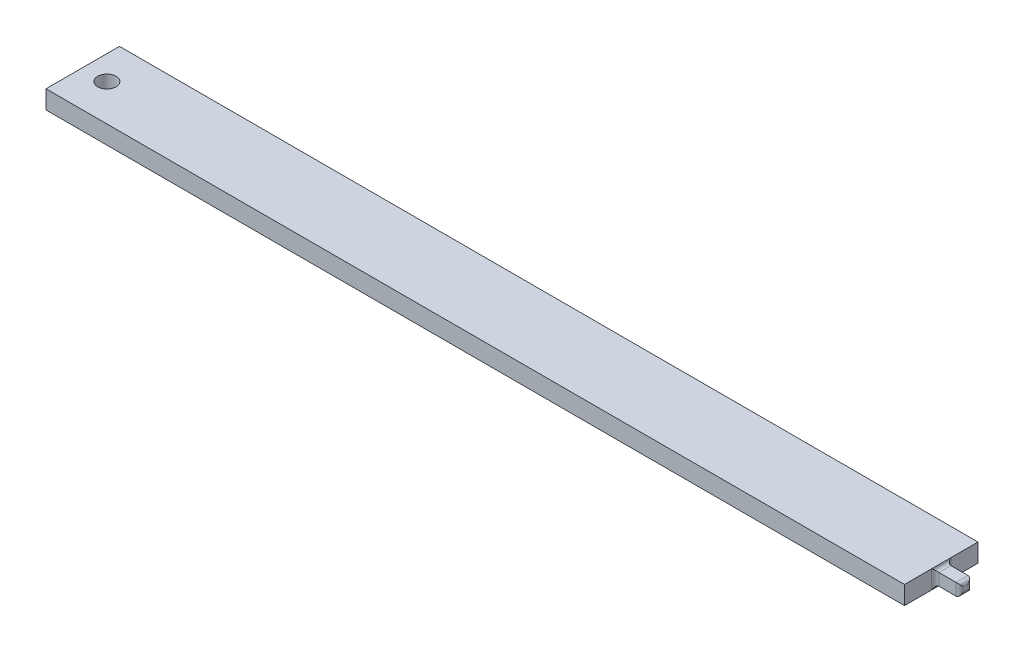
from build123d import *

# Parameters (mm, degrees)
SKETCH1_W           = 280.4
SKETCH1_H           = 12
BOSS_EXTRUDE1_DEPTH = 3
SKETCH3_R           = 1.5
CUT_EXTRUDE1_DEPTH  = 141.360393274
SKETCH6_W           = 140.2
SKETCH6_H           = 12
CUT_EXTRUDE2_DEPTH  = 141.360393274
SKETCH7_W           = 1.95
SKETCH7_H           = 1.95
BOSS_EXTRUDE2_DEPTH = 4
FILLET1_R           = 0.6


with BuildPart() as part:
    # Sketch1 → Boss-Extrude1 (new body)
    with BuildSketch(Plane(origin=(0, 0, 0), x_dir=(1, 0, 0), z_dir=(0, 1, 0))):
        Rectangle(SKETCH1_W, SKETCH1_H)
    extrude(amount=BOSS_EXTRUDE1_DEPTH)

    # Sketch3 → Cut-Extrude1 (cut, through all)
    with BuildSketch(Plane(origin=(0, 3, 0), x_dir=(1, 0, 0), z_dir=(0, 1, 0))):
        with Locations(Location((-136.25, 0, 0), (0, 0, 270))):
            Circle(SKETCH3_R)
        with Locations(Location((136.25, 0, 0), (0, 0, 270))):
            Circle(SKETCH3_R)
    extrude(amount=-CUT_EXTRUDE1_DEPTH, mode=Mode.SUBTRACT)

    # Sketch6 → Cut-Extrude2 (cut, through all)
    with BuildSketch(Plane(origin=(0, 3, 0), x_dir=(1, 0, 0), z_dir=(0, 1, 0))):
        with Locations((70.1, 0)):
            Rectangle(SKETCH6_W, SKETCH6_H)
    extrude(amount=-CUT_EXTRUDE2_DEPTH, mode=Mode.SUBTRACT)

    # Sketch7 → Boss-Extrude2 (add)
    with BuildSketch(Plane(origin=(0, 0, 0), x_dir=(0, 0, -1), z_dir=(1, 0, 0))):
        with Locations((0, 1.5)):
            Rectangle(SKETCH7_W, SKETCH7_H)
    extrude(amount=BOSS_EXTRUDE2_DEPTH)

    # Fillet1
    # the kernel refuses this fillet: 0.6 mm, written as the material it adds along each edge
    with BuildSketch(Plane(origin=(0, 0.525, -0.975), x_dir=(0, 0, -1), z_dir=(0, 1, 0)), Plane(origin=(0, 2.475, 0.975), x_dir=(0, 0, 1), z_dir=(0, -1, 0))) as fillet1_piece_1:
        with BuildLine():
            CenterArc((FILLET1_R, -FILLET1_R), FILLET1_R, 90, 90)
            Line((0, -FILLET1_R), (0, 0))
            Line((0, 0), (FILLET1_R, 0))
        make_face()
    fillet1_piece_1_solid = extrude(amount=1.95, mode=Mode.PRIVATE)
    with BuildSketch(Plane(origin=(0, 2.475, -0.975), x_dir=(0, 1, 0), z_dir=(0, 0, 1)), Plane(origin=(0, 0.525, 0.975), x_dir=(0, -1, 0), z_dir=(0, 0, -1))) as fillet1_piece_2:
        with BuildLine():
            CenterArc((0.6, -0.595294045), FILLET1_R, 97.180755781, 82.819244219)
            Line((0, -0.595294045), (0, 0))
            Line((0, 0), (0.525, 0))
        make_face()
    fillet1_piece_2_solid = extrude(amount=1.95, mode=Mode.PRIVATE)
    with BuildSketch(Plane(origin=(0, -0.975, -0.975), x_dir=(0, 0, -1), z_dir=(0, 1, 0))) as fillet1_piece_3a_section:
        with BuildLine():
            CenterArc((FILLET1_R, -FILLET1_R), FILLET1_R, 90, 90)
            Line((0, -FILLET1_R), (0, 0))
            Line((0, 0), (FILLET1_R, 0))
        make_face()
    fillet1_piece_3a = extrude(amount=3.45, mode=Mode.PRIVATE)
    fillet1_piece_3a = split(fillet1_piece_3a, bisect_by=Plane(origin=(0, 0, -0.975), z_dir=(0, 1, 0)), keep=Keep.TOP, mode=Mode.PRIVATE)
    fillet1_piece_3a = split(fillet1_piece_3a, bisect_by=Plane(origin=(0, 0.525, -0.975), z_dir=(0, -1, 0)), keep=Keep.TOP, mode=Mode.PRIVATE)
    with BuildSketch(Plane(origin=(0, 0.525, 0.975), x_dir=(0, -1, 0), z_dir=(0, 0, -1))) as fillet1_piece_3b_section:
        with BuildLine():
            CenterArc((0.6, -0.595294045), FILLET1_R, 97.180755781, 82.819244219)
            Line((0, -0.595294045), (0, 0))
            Line((0, 0), (0.525, 0))
        make_face()
    fillet1_piece_3b = extrude(amount=3.438235112, mode=Mode.PRIVATE)
    fillet1_piece_3b = split(fillet1_piece_3b, bisect_by=Plane(origin=(0, 0.525, -0.975), z_dir=(0, 0, -1)), keep=Keep.TOP, mode=Mode.PRIVATE)
    fillet1_piece_3 = fillet1_piece_3a & fillet1_piece_3b
    with BuildSketch(Plane(origin=(0, 2.475, -2.463235112), x_dir=(0, 1, 0), z_dir=(0, 0, 1))) as fillet1_piece_4a_section:
        with BuildLine():
            CenterArc((0.6, -0.595294045), FILLET1_R, 97.180755781, 82.819244219)
            Line((0, -0.595294045), (0, 0))
            Line((0, 0), (0.525, 0))
        make_face()
    fillet1_piece_4a = extrude(amount=3.438235112, mode=Mode.PRIVATE)
    fillet1_piece_4a = split(fillet1_piece_4a, bisect_by=Plane(origin=(0, 2.475, -0.975), z_dir=(0, 0, -1)), keep=Keep.TOP, mode=Mode.PRIVATE)
    with BuildSketch(Plane(origin=(0, 0.525, -0.975), x_dir=(0, 0, -1), z_dir=(0, 1, 0))) as fillet1_piece_4b_section:
        with BuildLine():
            CenterArc((FILLET1_R, -FILLET1_R), FILLET1_R, 90, 90)
            Line((0, -FILLET1_R), (0, 0))
            Line((0, 0), (FILLET1_R, 0))
        make_face()
    fillet1_piece_4b = extrude(amount=3.45, mode=Mode.PRIVATE)
    fillet1_piece_4b = split(fillet1_piece_4b, bisect_by=Plane(origin=(0, 3, -0.975), z_dir=(0, -1, 0)), keep=Keep.TOP, mode=Mode.PRIVATE)
    fillet1_piece_4b = split(fillet1_piece_4b, bisect_by=Plane(origin=(0, 2.475, -0.975), z_dir=(0, 1, 0)), keep=Keep.TOP, mode=Mode.PRIVATE)
    fillet1_piece_4 = fillet1_piece_4a & fillet1_piece_4b
    with BuildSketch(Plane(origin=(0, 3.975, 0.975), x_dir=(0, 0, 1), z_dir=(0, -1, 0))) as fillet1_piece_5a_section:
        with BuildLine():
            CenterArc((FILLET1_R, -FILLET1_R), FILLET1_R, 90, 90)
            Line((0, -FILLET1_R), (0, 0))
            Line((0, 0), (FILLET1_R, 0))
        make_face()
    fillet1_piece_5a = extrude(amount=3.45, mode=Mode.PRIVATE)
    fillet1_piece_5a = split(fillet1_piece_5a, bisect_by=Plane(origin=(0, 3, 0.975), z_dir=(0, -1, 0)), keep=Keep.TOP, mode=Mode.PRIVATE)
    fillet1_piece_5a = split(fillet1_piece_5a, bisect_by=Plane(origin=(0, 2.475, 0.975), z_dir=(0, 1, 0)), keep=Keep.TOP, mode=Mode.PRIVATE)
    with BuildSketch(Plane(origin=(0, 2.475, -0.975), x_dir=(0, 1, 0), z_dir=(0, 0, 1))) as fillet1_piece_5b_section:
        with BuildLine():
            CenterArc((0.6, -0.595294045), FILLET1_R, 97.180755781, 82.819244219)
            Line((0, -0.595294045), (0, 0))
            Line((0, 0), (0.525, 0))
        make_face()
    fillet1_piece_5b = extrude(amount=3.438235112, mode=Mode.PRIVATE)
    fillet1_piece_5b = split(fillet1_piece_5b, bisect_by=Plane(origin=(0, 2.475, 0.975), z_dir=(0, 0, 1)), keep=Keep.TOP, mode=Mode.PRIVATE)
    fillet1_piece_5 = fillet1_piece_5a & fillet1_piece_5b
    with BuildSketch(Plane(origin=(0, 2.475, 0.975), x_dir=(0, 0, 1), z_dir=(0, -1, 0))) as fillet1_piece_6a_section:
        with BuildLine():
            CenterArc((FILLET1_R, -FILLET1_R), FILLET1_R, 90, 90)
            Line((0, -FILLET1_R), (0, 0))
            Line((0, 0), (FILLET1_R, 0))
        make_face()
    fillet1_piece_6a = extrude(amount=3.45, mode=Mode.PRIVATE)
    fillet1_piece_6a = split(fillet1_piece_6a, bisect_by=Plane(origin=(0, 0, 0.975), z_dir=(0, 1, 0)), keep=Keep.TOP, mode=Mode.PRIVATE)
    fillet1_piece_6a = split(fillet1_piece_6a, bisect_by=Plane(origin=(0, 0.525, 0.975), z_dir=(0, -1, 0)), keep=Keep.TOP, mode=Mode.PRIVATE)
    with BuildSketch(Plane(origin=(0, 0.525, 2.463235112), x_dir=(0, -1, 0), z_dir=(0, 0, -1))) as fillet1_piece_6b_section:
        with BuildLine():
            CenterArc((0.6, -0.595294045), FILLET1_R, 97.180755781, 82.819244219)
            Line((0, -0.595294045), (0, 0))
            Line((0, 0), (0.525, 0))
        make_face()
    fillet1_piece_6b = extrude(amount=3.438235112, mode=Mode.PRIVATE)
    fillet1_piece_6b = split(fillet1_piece_6b, bisect_by=Plane(origin=(0, 0.525, 0.975), z_dir=(0, 0, 1)), keep=Keep.TOP, mode=Mode.PRIVATE)
    fillet1_piece_6 = fillet1_piece_6a & fillet1_piece_6b
    add([fillet1_piece_1_solid, fillet1_piece_2_solid, fillet1_piece_3, fillet1_piece_4, fillet1_piece_5, fillet1_piece_6])
    # the kernel refuses this fillet: 0.6 mm, written as the material it takes off along each edge
    with BuildSketch(Plane(origin=(4, -0.975, -0.975), x_dir=(0, 0, 1), z_dir=(0, 1, 0)), Plane(origin=(4, 2.475, -2.475), x_dir=(0, -1, 0), z_dir=(0, 0, 1)), Plane(origin=(4, 0.525, 2.475), x_dir=(0, 1, 0), z_dir=(0, 0, -1))) as fillet1_2_piece_1:
        with BuildLine():
            CenterArc((FILLET1_R, -FILLET1_R), FILLET1_R, 90, 90)
            Line((0, -FILLET1_R), (0, 0))
            Line((0, 0), (FILLET1_R, 0))
        make_face()
    fillet1_2_piece_1_solid = extrude(amount=4.95, mode=Mode.PRIVATE)
    with BuildSketch(Plane(origin=(4, 3.975, 0.975), x_dir=(-1, 0, 0), z_dir=(0, -1, 0))) as fillet1_2_piece_2:
        with BuildLine():
            CenterArc((FILLET1_R, FILLET1_R), FILLET1_R, 180, 90)
            Line((0, FILLET1_R), (0, 0))
            Line((0, 0), (FILLET1_R, 0))
        make_face()
    fillet1_2_piece_2_solid = extrude(amount=4.95, mode=Mode.PRIVATE)
    add([fillet1_2_piece_1_solid, fillet1_2_piece_2_solid], mode=Mode.SUBTRACT)


solid = part.part
